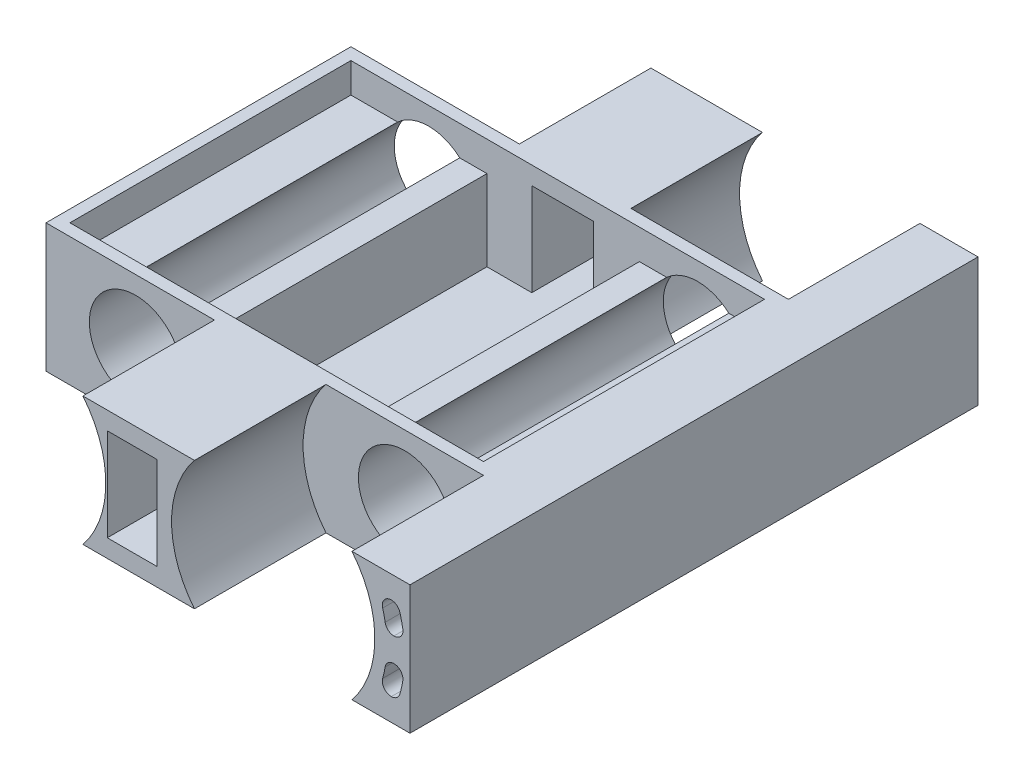
from build123d import *

# Parameters (mm, degrees)
SKETCH1_W           = 95
SKETCH1_H           = 95
BOSS_EXTRUDE1_DEPTH = 25
SKETCH2_R           = 7.75
CUT_EXTRUDE2_DEPTH  = 100
SKETCH3_R           = 17
CUT_EXTRUDE3_DEPTH  = 22
CUT_EXTRUDE4_START  = -22
SKETCH4_R           = 17
CUT_EXTRUDE4_DEPTH  = 22
SKETCH5_W           = 6.246993927
SKETCH5_H           = 25
CUT_EXTRUDE5_DEPTH  = 22
SKETCH6_W           = 7.178723585
SKETCH6_H           = 25
CUT_EXTRUDE6_DEPTH  = 22
SKETCH8_W           = 99.503929421
SKETCH8_H           = 3.5
CUT_EXTRUDE7_DEPTH  = 100
SKETCH9_W           = 8.3
SKETCH9_H           = 15.5
CUT_EXTRUDE11_DEPTH = 100
SKETCH13_W          = 87
SKETCH13_H          = 15.5
CUT_EXTRUDE12_DEPTH = 2
SKETCH14_W          = 25.5
SKETCH14_H          = 47
CUT_EXTRUDE14_DEPTH = 18.5
SKETCH16_W          = 24.75
SKETCH16_H          = 47
CUT_EXTRUDE15_DEPTH = 5
SKETCH17_W          = 20.919567191
SKETCH17_H          = 47
CUT_EXTRUDE16_DEPTH = 5
CUT_EXTRUDE17_DEPTH = 100
FILLET6_R           = 1.5
FILLET7_R           = 1.5
FILLET8_R           = 1.5
FILLET9_R           = 1.5
SKETCH19_W          = 12.12120401
SKETCH19_H          = 21.5
CUT_EXTRUDE20_DEPTH = 100


with BuildPart() as part:
    # Sketch1 → Boss-Extrude1 (new body)
    with BuildSketch(Plane(origin=(0, 0, 0), x_dir=(1, 0, 0), z_dir=(0, 1, 0))):
        with Locations((3.271948822, -17.506298191)):
            Rectangle(SKETCH1_W, SKETCH1_H)
    extrude(amount=BOSS_EXTRUDE1_DEPTH)

    # Sketch2 → Cut-Extrude2 (cut)
    with BuildSketch(Plane.XY.offset(65.006298191)):
        with Locations((-29.228051178, 10.75)):
            Circle(SKETCH2_R)
        with Locations((15.771948822, 10.75)):
            Circle(SKETCH2_R)
    extrude(amount=-CUT_EXTRUDE2_DEPTH, mode=Mode.SUBTRACT)

    # Sketch3 → Cut-Extrude3 (cut)
    with BuildSketch(Plane.XY.offset(65.006298191)):
        with Locations((-29.228051178, 10.75)):
            Circle(SKETCH3_R)
        with Locations((15.771948822, 10.75)):
            Circle(SKETCH3_R)
    extrude(amount=-CUT_EXTRUDE3_DEPTH, mode=Mode.SUBTRACT)

    # Sketch4 → Cut-Extrude4 (cut)
    with BuildSketch(Plane(origin=(0, 0, -29.993701809), x_dir=(-1, 0, 0), z_dir=(0, 0, -1)).offset(CUT_EXTRUDE4_START)):
        with Locations((-15.771948822, 10.75)):
            Circle(SKETCH4_R)
        with Locations((29.228051178, 10.75)):
            Circle(SKETCH4_R)
    extrude(amount=CUT_EXTRUDE4_DEPTH, mode=Mode.SUBTRACT)

    # Sketch5 → Cut-Extrude5 (cut)
    with BuildSketch(Plane.XY.offset(65.006298191)):
        with Locations((-41.104554214, 12.5)):
            Rectangle(SKETCH5_W, SKETCH5_H)
    extrude(amount=-CUT_EXTRUDE5_DEPTH, mode=Mode.SUBTRACT)

    # Sketch6 → Cut-Extrude6 (cut)
    with BuildSketch(Plane(origin=(0, 0, -29.993701809), x_dir=(-1, 0, 0), z_dir=(0, 0, -1))):
        with Locations((40.638689386, 12.5)):
            Rectangle(SKETCH6_W, SKETCH6_H)
    extrude(amount=-CUT_EXTRUDE6_DEPTH, mode=Mode.SUBTRACT)

    # Sketch8 → Cut-Extrude7 (cut)
    with BuildSketch(Plane(origin=(0, 0, -29.993701809), x_dir=(-1, 0, 0), z_dir=(0, 0, -1))):
        with Locations((-1.019984112, 23.25)):
            Rectangle(SKETCH8_W, SKETCH8_H)
    extrude(amount=-CUT_EXTRUDE7_DEPTH, mode=Mode.SUBTRACT)

    # Sketch9 → Cut-Extrude11 (cut)
    with BuildSketch(Plane.XY.offset(65.006298191)):
        with Locations((-7.828051178, 10.75)):
            Rectangle(SKETCH9_W, SKETCH9_H)
    extrude(amount=-CUT_EXTRUDE11_DEPTH, mode=Mode.SUBTRACT)

    # Sketch13 → Cut-Extrude12 (cut)
    with BuildSketch(Plane.ZY.offset(3.678051178)):
        with Locations((17.506298191, 10.75)):
            Rectangle(SKETCH13_W, SKETCH13_H)
    extrude(amount=-CUT_EXTRUDE12_DEPTH, mode=Mode.SUBTRACT)

    # Sketch14 → Cut-Extrude14 (cut)
    with BuildSketch(Plane(origin=(0, 21.5, 0), x_dir=(1, 0, 0), z_dir=(0, 1, 0))):
        with Locations((-6.728051178, -17.506298191)):
            Rectangle(SKETCH14_W, SKETCH14_H)
    extrude(amount=-CUT_EXTRUDE14_DEPTH, mode=Mode.SUBTRACT)

    # Sketch16 → Cut-Extrude15 (cut)
    with BuildSketch(Plane(origin=(0, 21.5, 0), x_dir=(1, 0, 0), z_dir=(0, 1, 0))):
        with Locations((-29.853051178, -17.506298191)):
            Rectangle(SKETCH16_W, SKETCH16_H)
    extrude(amount=-CUT_EXTRUDE15_DEPTH, mode=Mode.SUBTRACT)

    # Sketch17 → Cut-Extrude16 (cut)
    with BuildSketch(Plane(origin=(0, 21.5, 0), x_dir=(1, 0, 0), z_dir=(0, 1, 0))):
        with Locations((16.481732418, -17.506298191)):
            Rectangle(SKETCH17_W, SKETCH17_H)
    extrude(amount=-CUT_EXTRUDE16_DEPTH, mode=Mode.SUBTRACT)

    # Sketch18 → Cut-Extrude17 (cut)
    with BuildSketch(Plane.XY.offset(65.006298191)):
        with BuildLine():
            Line((34.66639245, 12.75), (37.680851122, 12.75))
            ThreePointArc((37.680851122, 12.75), (37.300376381, 15.28065192), (36.628602437, 17.75))
            Line((36.628602437, 17.75), (33.435470555, 17.75))
            ThreePointArc((33.435470555, 17.75), (34.221100776, 15.291893017), (34.66639245, 12.75))
        make_face()
        with BuildLine():
            Line((34.66639245, 8.75), (37.680851122, 8.75))
            ThreePointArc((37.680851122, 8.75), (37.300376381, 6.21934808), (36.628602437, 3.75))
            Line((36.628602437, 3.75), (33.435470555, 3.75))
            ThreePointArc((33.435470555, 3.75), (34.221100776, 6.208106983), (34.66639245, 8.75))
        make_face()
    extrude(amount=-CUT_EXTRUDE17_DEPTH, mode=Mode.SUBTRACT)

    # Fillet6
    fillet6_edges = [part.edges().sort_by_distance(p)[0] for p in [
        (33.435470555, 17.75, 17.506298191),
        (36.628602437, 17.75, 17.506298191),
    ]]
    fillet(fillet6_edges, radius=FILLET6_R - 0.0001)  # a hair under: the kernel refuses the full size

    # Fillet7
    fillet7_edges = [part.edges().sort_by_distance(p)[0] for p in [
        (37.680851122, 12.75, 17.506298191),
        (34.66639245, 12.75, 17.506298191),
    ]]
    fillet(fillet7_edges, radius=FILLET7_R - 0.0001)  # a hair under: the kernel refuses the full size

    # Fillet8
    fillet8_edges = [part.edges().sort_by_distance(p)[0] for p in [
        (33.435470555, 3.75, 17.506298191),
        (36.628602437, 3.75, 17.506298191),
    ]]
    fillet(fillet8_edges, radius=FILLET8_R - 0.0001)  # a hair under: the kernel refuses the full size

    # Fillet9
    fillet9_edges = [part.edges().sort_by_distance(p)[0] for p in [
        (37.680851122, 8.75, 17.506298191),
        (34.66639245, 8.75, 17.506298191),
    ]]
    fillet(fillet9_edges, radius=FILLET9_R - 0.0001)  # a hair under: the kernel refuses the full size

    # Sketch19 → Cut-Extrude20 (cut)
    with BuildSketch(Plane.XY.offset(65.006298191)):
        with Locations((44.711346817, 10.75)):
            Rectangle(SKETCH19_W, SKETCH19_H)
    extrude(amount=-CUT_EXTRUDE20_DEPTH, mode=Mode.SUBTRACT)


solid = part.part
